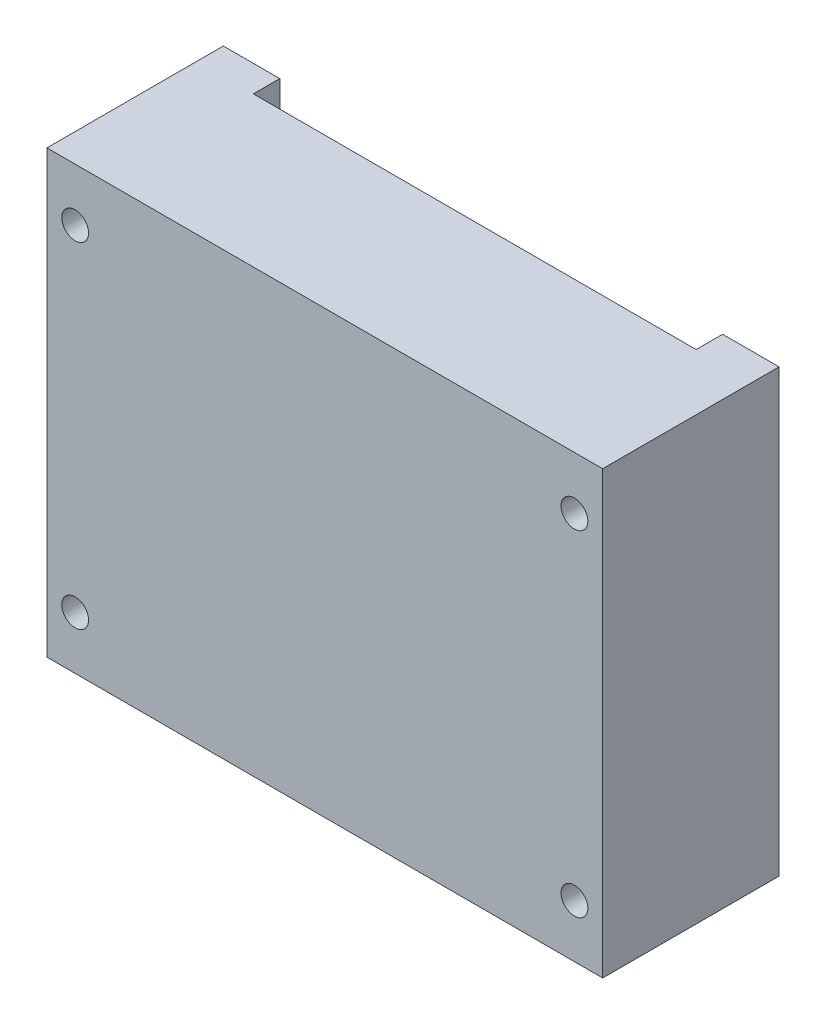
from build123d import *

# Parameters (mm, degrees)
SKETCH1_W               = 80.01
SKETCH1_H               = 63.5
BOSS_EXTRUDE1_DEPTH     = 25.4
SKETCH2_W               = 63.754
SKETCH2_H               = 57.15
CUT_EXTRUDE1_DEPTH      = 22.86
CUT_EXTRUDE2_DEPTH      = 58.040534053
CUT_EXTRUDE2_DEPTH_BACK = 58.040534053
SKETCH3_W               = 63.754
SKETCH3_H               = 3.81
F_8_CLEARANCE_HOLE1_D   = 3.8608
SKETCH13_W              = 10.16
SKETCH13_H              = 16.51
CUT_EXTRUDE3_DEPTH      = 50.8


with BuildPart() as part:
    # Sketch1 → Boss-Extrude1 (new body)
    with BuildSketch(Plane.XY):
        Rectangle(SKETCH1_W, SKETCH1_H)
    extrude(amount=BOSS_EXTRUDE1_DEPTH)

    # Sketch2 → Cut-Extrude1 (cut)
    with BuildSketch(Plane.XY):
        Rectangle(SKETCH2_W, SKETCH2_H)
    extrude(amount=CUT_EXTRUDE1_DEPTH, mode=Mode.SUBTRACT)

    # Sketch3 → Cut-Extrude2 (cut, two sides: drawn at the far end of the back side and taken through both)
    with BuildSketch(Plane(origin=(0, 0, 0), x_dir=(1, 0, 0), z_dir=(0, 1, 0)).offset(-CUT_EXTRUDE2_DEPTH_BACK)):
        with Locations((0, -1.905)):
            Rectangle(SKETCH3_W, SKETCH3_H)
    extrude(amount=CUT_EXTRUDE2_DEPTH + CUT_EXTRUDE2_DEPTH_BACK, mode=Mode.SUBTRACT)

    # #8 Clearance Hole1 (through all)
    with Locations(Plane(origin=(0, 0, 0), x_dir=(-1, 0, 0), z_dir=(0, 0, -1))):
        with Locations((-35.941, 24.13), (-35.941, -24.13), (35.941, -24.13), (35.941, 24.13)):
            Hole(F_8_CLEARANCE_HOLE1_D / 2)

    # Sketch13 → Cut-Extrude3 (cut)
    with BuildSketch(Plane(origin=(0, 0, 0), x_dir=(1, 0, 0), z_dir=(0, 1, 0))):
        with Locations((0, -12.065)):
            Rectangle(SKETCH13_W, SKETCH13_H)
    extrude(amount=-CUT_EXTRUDE3_DEPTH, mode=Mode.SUBTRACT)


solid = part.part
